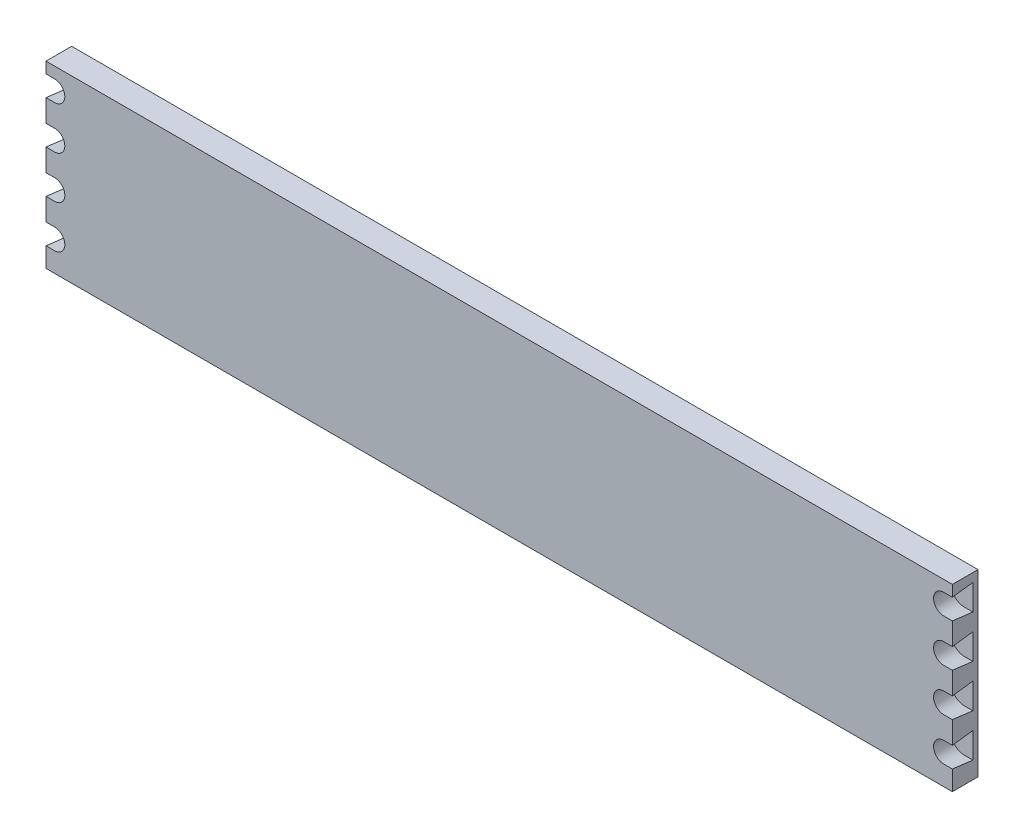
from build123d import *

# Parameters (mm, degrees)
SKETCH1_W           = 105
SKETCH1_H           = 530
BOSS_EXTRUDE1_DEPTH = 7.5
LPATTERN1_COUNT     = 4
LPATTERN1_PITCH     = 25


# Read off the part's stored shape, not the designer's step: Mirror1
with BuildPart() as part:
    # Sketch1 → Boss-Extrude1 (new, symmetric)
    with BuildSketch(Plane(origin=(0, 0, 0), x_dir=(0, -1, 0), z_dir=(0, 0, 1))):
        Rectangle(SKETCH1_W, SKETCH1_H)
    extrude(amount=BOSS_EXTRUDE1_DEPTH, both=True)

    # Sketch2 → Cut-Loft1 section 0
    with BuildSketch(Plane.XY.offset(-4.5)):
        with BuildLine():
            Line((265, 47.5), (265, 32.5))
            Line((265, 32.5), (260, 32.5))
            ThreePointArc((260, 32.5), (252.5, 40), (260, 47.5))
            Line((260, 47.5), (265, 47.5))
        make_face()
    # Sketch3 → Cut-Loft1 section 1
    with BuildSketch(Plane.XY.offset(7.5)):
        with BuildLine():
            Line((265, 46), (265, 34))
            Line((265, 34), (260, 34))
            ThreePointArc((260, 34), (254, 40), (260, 46))
            Line((260, 46), (265, 46))
        make_face()
    cut_loft1 = loft(mode=Mode.SUBTRACT)

    # LPattern1: Cut-Loft1 ×4
    with Locations(*[(0, -i * LPATTERN1_PITCH, 0) for i in range(1, LPATTERN1_COUNT)]):
        add(cut_loft1, mode=Mode.SUBTRACT)

    # Mirror1
    split(bisect_by=Plane(origin=(0, 0, 0), x_dir=(0, 0, 1), z_dir=(1, 0, 0)), keep=Keep.TOP)

    # Mirror1 2: part across plane


with BuildPart() as part_1:
    add(part.part)
    add(part.part.mirror(Plane(origin=(0, 0, 0), x_dir=(0, 0, 1), z_dir=(1, 0, 0))))


solid = part_1.part
